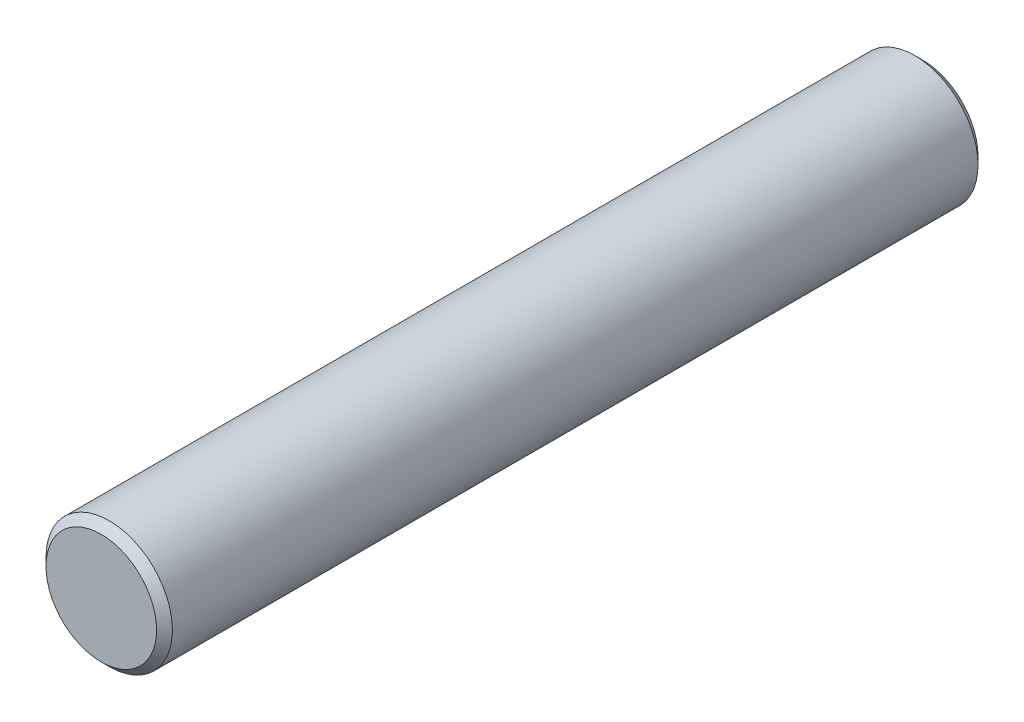
from build123d import *

# Parameters (mm, degrees)
SKETCH_1_R      = 4
EXTRUDE_1_DEPTH = 52
CHAMFER_1_SIZE  = 0.5


with BuildPart() as part:
    # Эскиз1 → Вытянуть1 (new body)
    with BuildSketch(Plane.XY):
        Circle(SKETCH_1_R)
    extrude(amount=EXTRUDE_1_DEPTH)

    # Фаска1
    chamfer_1_edges = [part.edges().sort_by_distance(p)[0] for p in [
        (-4, 0, 52),
        (-4, 0, 0),
    ]]
    chamfer(chamfer_1_edges, length=CHAMFER_1_SIZE)


solid = part.part
